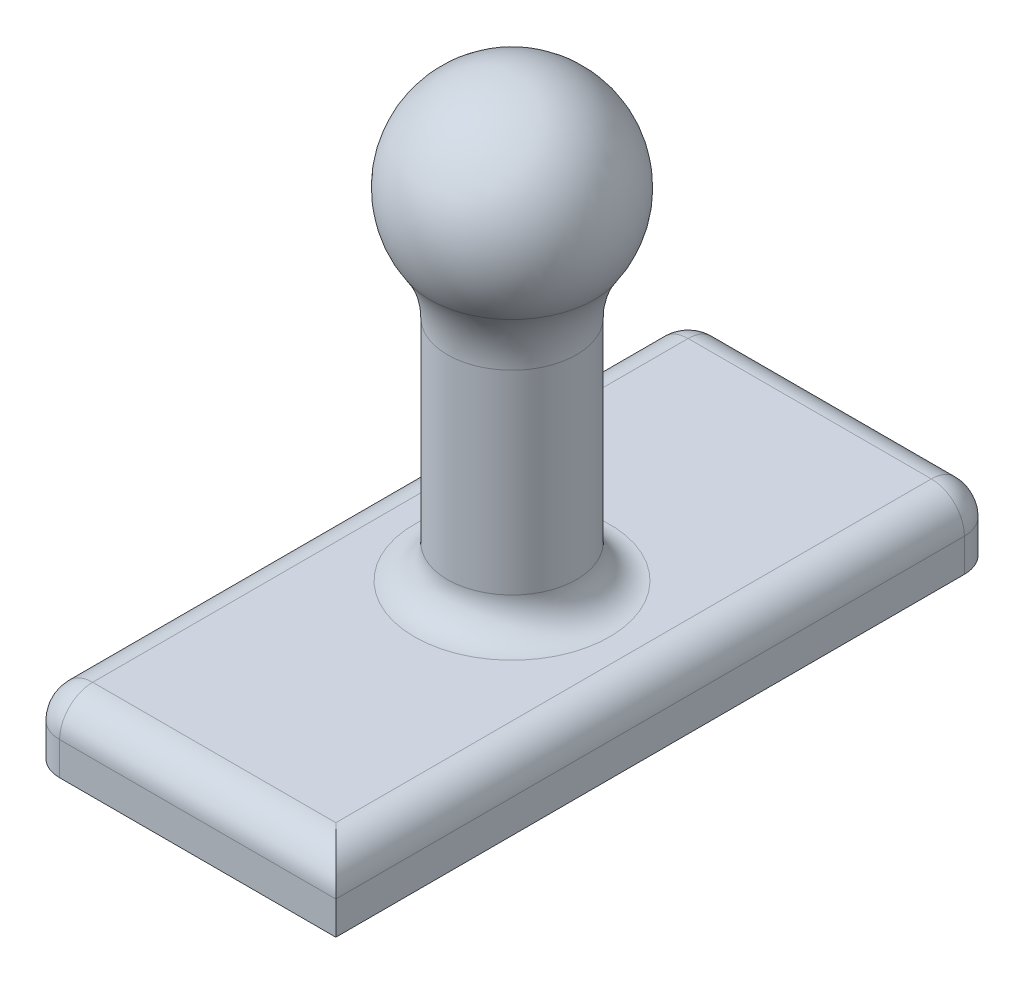
from build123d import *

# Parameters (mm, degrees)
CROQUIS2_R              = 1.95
SALIENTE_EXTRUIR1_DEPTH = 8
C_PULA1_FACE_RADIUS     = 1.95
C_PULA1_HEIGHT          = 5.3
CROQUIS11_W             = 9.35
CROQUIS11_H             = 20
SALIENTE_EXTRUIR3_DEPTH = 2
FILLET1_R               = 1
FILLET2_R               = 1
FILLET3_R               = 3


with BuildPart() as part:
    # Croquis2 → Saliente-Extruir1 (new body)
    with BuildSketch(Plane(origin=(0, 0, 0), x_dir=(1, 0, 0), z_dir=(0, 1, 0))):
        with Locations(Location((0, 0, 0), (0, 0, 270))):
            Circle(CROQUIS2_R)
    extrude(amount=SALIENTE_EXTRUIR1_DEPTH)

    # Cúpula1: a dome of height H over a round flat face of radius A is a cap of a sphere of radius (A * A + H * H) / (2 * H)
    c_pula1_r = (C_PULA1_FACE_RADIUS * C_PULA1_FACE_RADIUS + C_PULA1_HEIGHT * C_PULA1_HEIGHT) / (2 * C_PULA1_HEIGHT)
    c_pula1_base = Plane((0, 8, 0), z_dir=(0, 1, 0))
    with Locations(c_pula1_base.offset(C_PULA1_HEIGHT - c_pula1_r)):
        c_pula1_ball = Sphere(c_pula1_r, mode=Mode.PRIVATE)
    add(split(c_pula1_ball, bisect_by=c_pula1_base, keep=Keep.TOP, mode=Mode.PRIVATE))

    # Croquis11 → Saliente-Extruir3 (add)
    with BuildSketch(Plane(origin=(0, 0, 0), x_dir=(-1, 0, 0), z_dir=(0, -1, 0))):
        Rectangle(CROQUIS11_W, CROQUIS11_H)
    extrude(amount=SALIENTE_EXTRUIR3_DEPTH)

    # Fillet1
    fillet1_edges = [part.edges().sort_by_distance(p)[0] for p in [
        (0, 0, -1.95),
        (0, 0, -10),
        (4.675, 0, 0),
        (-4.675, 0, 0),
        (0, 0, 10),
    ]]
    fillet(fillet1_edges, radius=FILLET1_R)

    # Fillet2
    # the kernel refuses this fillet: 1 mm, written as the material it takes off along each edge
    with BuildSketch(Plane(origin=(-3.675, -1, 9), x_dir=(0, 0, 1), z_dir=(-1, 0, 0))) as fillet2_piece_1_section:
        Polygon((0, 0), (FILLET2_R, 0), (FILLET2_R, FILLET2_R), (0, FILLET2_R), align=None)
    fillet2_piece_1 = extrude(amount=FILLET2_R, mode=Mode.PRIVATE)
    fillet2_piece_1 = fillet2_piece_1 - Plane(origin=(-3.675, -1, 9), x_dir=(0, -0.7071067811865475, -0.7071067811865475), z_dir=(-1, 0, 0)) * Sphere(FILLET2_R, mode=Mode.PRIVATE)
    add(fillet2_piece_1, mode=Mode.SUBTRACT)
    with BuildSketch(Plane(origin=(-3.675, -1, -9), x_dir=(-1, 0, 0), z_dir=(0, 0, -1))) as fillet2_piece_2_section:
        Polygon((0, 0), (FILLET2_R, 0), (FILLET2_R, FILLET2_R), (0, FILLET2_R), align=None)
    fillet2_piece_2 = extrude(amount=FILLET2_R, mode=Mode.PRIVATE)
    fillet2_piece_2 = fillet2_piece_2 - Plane(origin=(-3.675, -1, -9), x_dir=(0.7071067811865475, -0.7071067811865475, 0), z_dir=(0, 0, -1)) * Sphere(FILLET2_R, mode=Mode.PRIVATE)
    add(fillet2_piece_2, mode=Mode.SUBTRACT)
    with BuildSketch(Plane(origin=(3.675, -1, -9), x_dir=(1, 0, 0), z_dir=(0, 0, -1))) as fillet2_piece_3_section:
        Polygon((0, 0), (FILLET2_R, 0), (FILLET2_R, -FILLET2_R), (0, -FILLET2_R), align=None)
    fillet2_piece_3 = extrude(amount=FILLET2_R, mode=Mode.PRIVATE)
    fillet2_piece_3 = fillet2_piece_3 - Plane(origin=(3.675, -1, -9), x_dir=(-0.7071067811865475, -0.7071067811865475, 0), z_dir=(0, 0, -1)) * Sphere(FILLET2_R, mode=Mode.PRIVATE)
    add(fillet2_piece_3, mode=Mode.SUBTRACT)
    with BuildSketch(Plane(origin=(-4.675, -1, 10), x_dir=(0, 0, -1), z_dir=(0, -1, 0)), Plane(origin=(-4.675, -1, -10), x_dir=(1, 0, 0), z_dir=(0, -1, 0))) as fillet2_piece_4:
        with BuildLine():
            CenterArc((FILLET2_R, FILLET2_R), FILLET2_R, 180, 90)
            Line((0, FILLET2_R), (0, 0))
            Line((0, 0), (FILLET2_R, 0))
        make_face()
    extrude(amount=3.5, mode=Mode.SUBTRACT)
    with BuildSketch(Plane(origin=(4.675, -1, -10), x_dir=(-1, 0, 0), z_dir=(0, -1, 0))) as fillet2_piece_5:
        with BuildLine():
            CenterArc((FILLET2_R, -FILLET2_R), FILLET2_R, 90, 90)
            Line((0, -FILLET2_R), (0, 0))
            Line((0, 0), (FILLET2_R, 0))
        make_face()
    extrude(amount=3.5, mode=Mode.SUBTRACT)

    # Fillet3
    fillet3_edges = [part.edges().sort_by_distance(p)[0] for p in [
        (0, 8, -1.95),
    ]]
    fillet(fillet3_edges, radius=FILLET3_R)


solid = part.part
